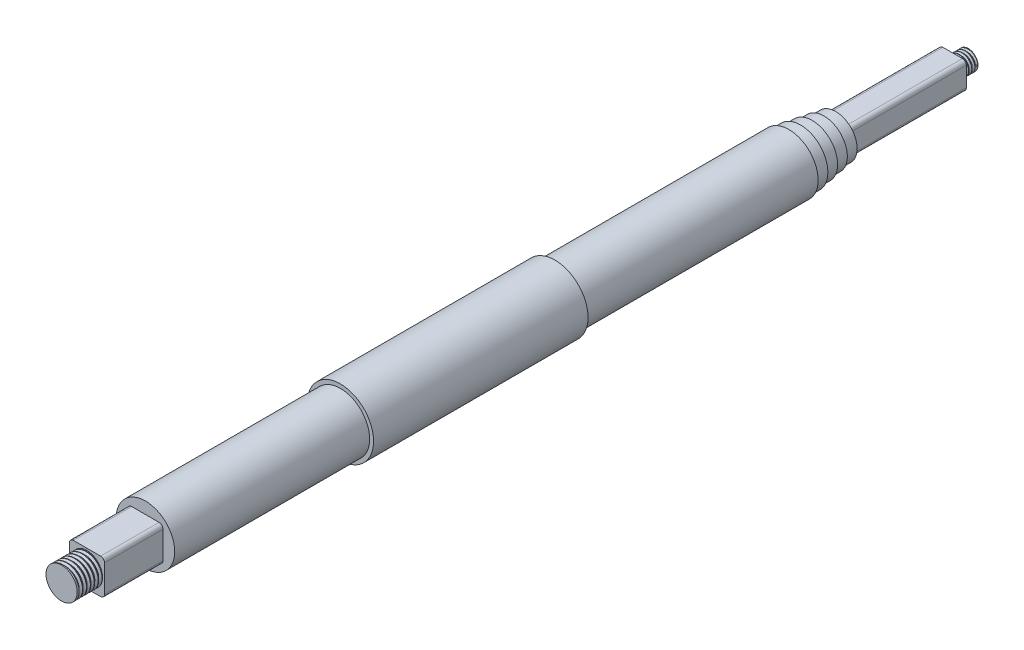
from build123d import *

# Parameters (mm, degrees)
SKETCH3_W           = 9
SKETCH3_H           = 9
BOSS_EXTRUDE1_DEPTH = 15
SKETCH4_R           = 4
BOSS_EXTRUDE2_DEPTH = 6.5
SKETCH5_W           = 7
SKETCH5_H           = 7
BOSS_EXTRUDE3_DEPTH = 30
SKETCH6_R           = 2.5
BOSS_EXTRUDE4_DEPTH = 4
FILLET2_R           = 1
FILLET3_R           = 1
THREAD1_PITCH       = 1
THREAD2_PITCH       = 0.8


with BuildPart() as part:
    # Sketch1 → Revolve1 (revolve)
    with BuildSketch(Plane(origin=(0, 0, 0), x_dir=(1, 0, 0), z_dir=(0, 1, 0))):
        Polygon((7.5, 0), (0, 0), (0, 177), (5.5, 177), (5.5, 174), (6, 174), (6, 171), (6.5, 171), (6.5, 168), (7, 168), (7, 165), (7.5, 165), (7.5, 105), (8.5, 105), (8.5, 50), (7.5, 50), align=None)
    revolve(axis=Axis((0, 0, 0), (0, 0, -1)))

    # Sketch3 → Boss-Extrude1 (add)
    with BuildSketch(Plane.XY):
        Rectangle(SKETCH3_W, SKETCH3_H)
    extrude(amount=BOSS_EXTRUDE1_DEPTH)

    # Sketch4 → Boss-Extrude2 (add)
    with BuildSketch(Plane.XY.offset(15)):
        with Locations(Location((0, 0, 0), (0, 0, 180))):
            Circle(SKETCH4_R)
    extrude(amount=BOSS_EXTRUDE2_DEPTH)

    # Sketch5 → Boss-Extrude3 (add)
    with BuildSketch(Plane(origin=(0, 0, -177), x_dir=(-1, 0, 0), z_dir=(0, 0, -1))):
        Rectangle(SKETCH5_W, SKETCH5_H)
    extrude(amount=BOSS_EXTRUDE3_DEPTH)

    # Sketch6 → Boss-Extrude4 (add)
    with BuildSketch(Plane(origin=(0, 0, -207), x_dir=(-1, 0, 0), z_dir=(0, 0, -1))):
        Circle(SKETCH6_R)
    extrude(amount=BOSS_EXTRUDE4_DEPTH)

    # Fillet2
    fillet2_edges = [part.edges().sort_by_distance(p)[0] for p in [
        (4.5, -4.5, 7.5),
        (4.5, 4.5, 7.5),
        (-4.5, 4.5, 7.5),
        (-4.5, -4.5, 7.5),
    ]]
    fillet(fillet2_edges, radius=FILLET2_R)

    # Fillet3
    fillet3_edges = [part.edges().sort_by_distance(p)[0] for p in [
        (-3.5, -3.5, -192),
        (-3.5, 3.5, -192),
        (3.5, 3.5, -192),
        (3.5, -3.5, -192),
    ]]
    fillet(fillet3_edges, radius=FILLET3_R)

    # Thread1: the profile of Thread Profile1 profile screwed along a right-hand helix of 6.5 turns, 8 arcs to a turn; built about Z, then put on its axis
    thread1_z = Axis((0, 0, 0), (0, 0, 1))
    thread1_corners = [(4.0003, 0, -0.000173205), (4.0003, 0, 0.875173202), (3.458734125, 0, 0.562499999), (3.458734125, 0, 0.312499999)]
    with BuildLine(mode=Mode.PRIVATE) as thread1_profile:
        Line(thread1_corners[0], thread1_corners[1])
        Line(thread1_corners[1], thread1_corners[2])
        Line(thread1_corners[2], thread1_corners[3])
        Line(thread1_corners[3], thread1_corners[0])
    thread1_cap = Face(thread1_profile.wire())
    thread1_turn_angles = [0, 22.5, 45, 67.5, 90, 112.5, 135, 157.5, 180, 202.5, 225, 247.5, 270, 292.5, 315, 337.5, 360]
    thread1_turn_weights = [1, 0.9238795325112867, 1, 0.9238795325112867, 1, 0.9238795325112867, 1, 0.9238795325112867, 1, 0.9238795325112867, 1, 0.9238795325112867, 1, 0.9238795325112867, 1, 0.9238795325112867, 1]
    thread1_turn_rails = [Edge.make_bspline([Vector(p[0], p[1], 0).rotate(thread1_z, thread1_turn_angles[k]) / thread1_turn_weights[k] + Vector(0, 0, p[2] + THREAD1_PITCH * thread1_turn_angles[k] / 360) for k in range(17)], [0, 0, 0, 1, 1, 2, 2, 3, 3, 4, 4, 5, 5, 6, 6, 7, 7, 8, 8, 8], 2, thread1_turn_weights) for p in thread1_corners]
    thread1_turn_sides = [Face.make_surface_from_curves(thread1_turn_rails[p[0]], thread1_turn_rails[p[1]]) for p in [(0, 1), (1, 2), (2, 3), (3, 0)]]
    thread1_last_angles = [2160, 2182.5, 2205, 2227.5, 2250, 2272.5, 2295, 2317.5, 2340]
    thread1_last_weights = [1, 0.9238795325112867, 1, 0.9238795325112867, 1, 0.9238795325112867, 1, 0.9238795325112883, 1]
    thread1_last_rails = [Edge.make_bspline([Vector(p[0], p[1], 0).rotate(thread1_z, thread1_last_angles[k]) / thread1_last_weights[k] + Vector(0, 0, p[2] + THREAD1_PITCH * thread1_last_angles[k] / 360) for k in range(9)], [0, 0, 0, 1, 1, 2, 2, 3, 3, 4, 4, 4], 2, thread1_last_weights) for p in thread1_corners]
    thread1_last_sides = [Face.make_surface_from_curves(thread1_last_rails[p[0]], thread1_last_rails[p[1]]) for p in [(0, 1), (1, 2), (2, 3), (3, 0)]]
    thread1 = Plane(origin=(0, 0, 21.5), x_dir=(-1, 0, 0), z_dir=(0, 0, -1)) * Solid(Shell([*[p.moved(Location((0, 0, THREAD1_PITCH * i))) for i in range(6) for p in thread1_turn_sides], *thread1_last_sides, thread1_cap, thread1_cap.rotate(thread1_z, 2340).moved(Location((0, 0, THREAD1_PITCH * 2340 / 360)))]))
    add(thread1, mode=Mode.SUBTRACT)

    # Thread2: the profile of Thread Profile2 profile screwed along a right-hand helix of 5 turns, 8 arcs to a turn; built about Z, then put on its axis
    thread2_z = Axis((0, 0, 0), (0, 0, 1))
    thread2_corners = [(2.5003, 0, -0.000173205), (2.5003, 0, 0.700173203), (2.0669873, 0, 0.449999999), (2.0669873, 0, 0.249999999)]
    with BuildLine(mode=Mode.PRIVATE) as thread2_profile:
        Line(thread2_corners[0], thread2_corners[1])
        Line(thread2_corners[1], thread2_corners[2])
        Line(thread2_corners[2], thread2_corners[3])
        Line(thread2_corners[3], thread2_corners[0])
    thread2_cap = Face(thread2_profile.wire())
    thread2_turn_angles = [0, 22.5, 45, 67.5, 90, 112.5, 135, 157.5, 180, 202.5, 225, 247.5, 270, 292.5, 315, 337.5, 360]
    thread2_turn_weights = [1, 0.9238795325112867, 1, 0.9238795325112867, 1, 0.9238795325112867, 1, 0.9238795325112867, 1, 0.9238795325112867, 1, 0.9238795325112867, 1, 0.9238795325112867, 1, 0.9238795325112867, 1]
    thread2_turn_rails = [Edge.make_bspline([Vector(p[0], p[1], 0).rotate(thread2_z, thread2_turn_angles[k]) / thread2_turn_weights[k] + Vector(0, 0, p[2] + THREAD2_PITCH * thread2_turn_angles[k] / 360) for k in range(17)], [0, 0, 0, 1, 1, 2, 2, 3, 3, 4, 4, 5, 5, 6, 6, 7, 7, 8, 8, 8], 2, thread2_turn_weights) for p in thread2_corners]
    thread2_turn_sides = [Face.make_surface_from_curves(thread2_turn_rails[p[0]], thread2_turn_rails[p[1]]) for p in [(0, 1), (1, 2), (2, 3), (3, 0)]]
    thread2 = Plane(origin=(0, 0, -211), x_dir=(1, 0, 0), z_dir=(0, 0, 1)) * Solid(Shell([*[p.moved(Location((0, 0, THREAD2_PITCH * i))) for i in range(5) for p in thread2_turn_sides], thread2_cap, thread2_cap.rotate(thread2_z, 1800).moved(Location((0, 0, THREAD2_PITCH * 1800 / 360)))]))
    add(thread2, mode=Mode.SUBTRACT)


solid = part.part
